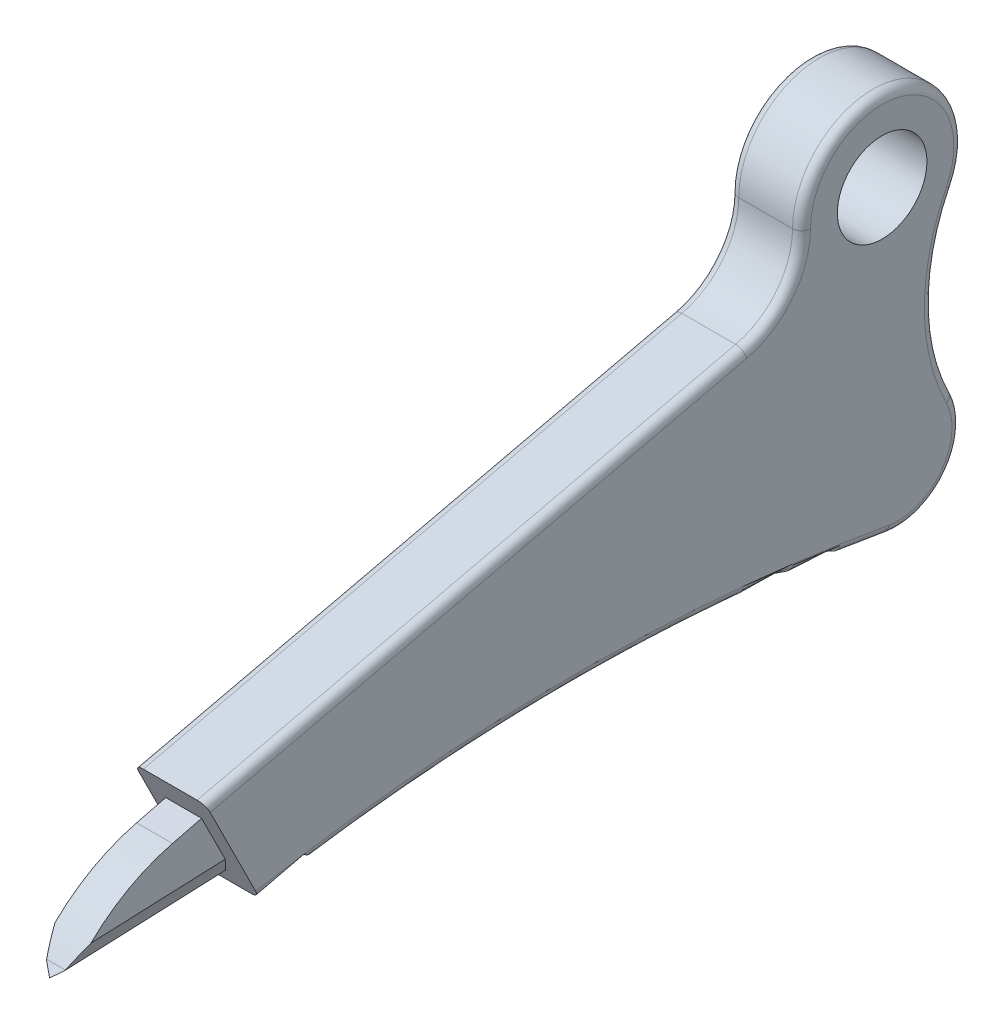
from build123d import *

# Parameters (mm, degrees)
SKETCH1_R           = 6.35
BOSS_EXTRUDE1_DEPTH = 5.08
FILLET1_R           = 1.27
BOSS_EXTRUDE2_DEPTH = 2.54
CHAMFER1_SIZE       = 3.81
CHAMFER1_SIZE_2     = 1.776632178
FILLET2_R           = 25.4


with BuildPart() as part:
    # Sketch1 → Boss-Extrude1 (new, symmetric)
    with BuildSketch(Plane(origin=(0, 0, 0), x_dir=(0, 0, -1), z_dir=(1, 0, 0))):
        with BuildLine():
            Line((-88.177460957, -43.18), (-95.797460957, -27.94))
            Line((-95.797460957, -27.94), (-19.494713075, -10.16))
            ThreePointArc((-19.494713075, -10.16), (-13.691248965, -6.485853779), (-11.43, 0))
            ThreePointArc((-11.43, 0), (2.608865683, 11.128284677), (10.23906734, -5.08))
            ThreePointArc((10.23906734, -5.08), (7.261735691, -17.78), (10.23906734, -30.48))
            ThreePointArc((10.23906734, -30.48), (9.389887981, -39.759205985), (0.722539043, -43.18))
            ThreePointArc((0.722539043, -43.18), (-43.727460957, -39.260382077), (-88.177460957, -43.18))
        make_face()
        Circle(SKETCH1_R, mode=Mode.SUBTRACT)
    extrude(amount=BOSS_EXTRUDE1_DEPTH, both=True)

    # Fillet1
    fillet1_edges = [part.edges().sort_by_distance(p)[0] for p in [
        (5.08, -39.260382077, 43.727460957),
        (5.08, -39.759205985, -9.389887981),
        (5.08, -17.78, -7.261735691),
        (5.08, 11.128284677, -2.608865683),
        (5.08, -6.485853779, 13.691248965),
        (-5.08, 11.128284677, -2.608865683),
        (5.08, -19.05, 57.646087016),
        (-5.08, -17.78, -7.261735691),
        (-5.08, -39.759205985, -9.389887981),
        (-5.08, -39.260382077, 43.727460957),
        (-5.08, -19.05, 57.646087016),
        (-5.08, -6.485853779, 13.691248965),
    ]]
    fillet(fillet1_edges, radius=FILLET1_R)

    # Sketch3 → Boss-Extrude2 (add, symmetric)
    with BuildSketch(Plane(origin=(0, 0, 0), x_dir=(0, 0, -1), z_dir=(1, 0, 0))):
        Polygon((-93.892460957, -31.75), (-106.592460957, -34.925), (-112.942460957, -43.18), (-92.622460957, -42.339662192), (-43.915351624, -37.990451226), align=None)
    extrude(amount=BOSS_EXTRUDE2_DEPTH, both=True)

    # Chamfer1
    # the kernel refuses this chamfer: 3.81, 1.776632178 mm, written as the material it takes off along each edge
    with BuildSketch(Plane(origin=(-2.54, -43.587894094, 122.805646834), x_dir=(-0.016311164131110324, 0.9990130464553615, 0.041314391398951954), z_dir=(0, 0.041319888426956664, -0.999145968725483))) as chamfer1_piece_1_section:
        Polygon((CHAMFER1_SIZE * 0.999866964113, CHAMFER1_SIZE * 0.0163111641311), (-CHAMFER1_SIZE_2 * 0.0163111641272, CHAMFER1_SIZE_2 * 0.999866963871), (0, 0), align=None)
    chamfer1_piece_1 = extrude(amount=40.080601841, mode=Mode.PRIVATE)
    chamfer1_piece_1 = split(chamfer1_piece_1, bisect_by=Plane(origin=(-1.976451392, -34.769993735, 92.38246409), z_dir=(0, -0.44721359549995887, 0.8944271909999154)), keep=Keep.TOP, mode=Mode.PRIVATE)
    add(chamfer1_piece_1, mode=Mode.SUBTRACT)
    with BuildSketch(Plane(origin=(2.54, -43.587894094, 122.805646834), x_dir=(0.016311164131110324, 0.9990130464553615, 0.041314391398951954), z_dir=(0, 0.041319888426956664, -0.999145968725483))) as chamfer1_piece_2_section:
        Polygon((CHAMFER1_SIZE * 0.999866964113, -CHAMFER1_SIZE * 0.0163111641311), (-CHAMFER1_SIZE_2 * 0.0163111641272, -CHAMFER1_SIZE_2 * 0.999866963871), (0, 0), align=None)
    chamfer1_piece_2 = extrude(amount=40.080601841, mode=Mode.PRIVATE)
    chamfer1_piece_2 = split(chamfer1_piece_2, bisect_by=Plane(origin=(1.976451392, -34.769993735, 92.38246409), z_dir=(0, -0.44721359549995887, 0.8944271909999154)), keep=Keep.TOP, mode=Mode.PRIVATE)
    add(chamfer1_piece_2, mode=Mode.SUBTRACT)

    # Fillet2
    fillet2_edges = [part.edges().sort_by_distance(p)[0] for p in [
        (0, -34.925, 106.592460957),
    ]]
    fillet(fillet2_edges, radius=FILLET2_R)

    # Chamfer2
    # the kernel refuses this chamfer: 1.27, 0.83499617 mm, written as the material it takes off along each edge
    with BuildSketch(Plane(origin=(-0.763367822, -43.506315275, 120.833009659), x_dir=(0.9993026620124814, -0.03730696112582517, -0.0015428371024072082), z_dir=(0, 0.04131988842701986, -0.9991459687254804))) as chamfer2_piece_1_section:
        with BuildLine():
            Line((0.874521065, 0), (-0.619435505, -1.161345341))
            Line((-0.619435505, -1.161345341), (-0.642038856, -1.149758774))
            ThreePointArc((-0.642038856, -1.149758774), (-0.322768515, -0.573982799), (-0.022603351, 0.011586567))
            Line((-0.022603351, 0.011586567), (0.000948407, 0.025382288))
            ThreePointArc((0.000948407, 0.025382288), (0.437599315, 0.009066868), (0.875469472, 0.025382288))
            Line((0.875469472, 0.025382288), (0.874521065, 0))
        make_face()
    chamfer2_piece_1 = extrude(amount=36.131955223, mode=Mode.PRIVATE)
    chamfer2_piece_1 = split(chamfer2_piece_1, bisect_by=Plane(origin=(-0.672553729, -35.934823141, 91.800049387), z_dir=(0, -0.44721359549995887, 0.8944271909999154)), keep=Keep.TOP, mode=Mode.PRIVATE)
    add(chamfer2_piece_1, mode=Mode.SUBTRACT)
    with BuildSketch(Plane(origin=(0.763367822, -43.506315275, 120.833009659), x_dir=(0.4373449734128742, 0.8985257946973667, 0.03715872029494756), z_dir=(0, 0.04131988842701986, -0.9991459687254804))) as chamfer2_piece_2_section:
        with BuildLine():
            Line((1.316215539, 0), (-0.411565873, -0.771622074))
            Line((-0.411565873, -0.771622074), (-0.434407936, -0.760513512))
            ThreePointArc((-0.434407936, -0.760513512), (-0.213942404, -0.381842921), (-0.022842063, 0.011108562))
            Line((-0.022842063, 0.011108562), (0.000414304, 0.025396621))
            ThreePointArc((0.000414304, 0.025396621), (0.658346981, 0.014663545), (1.316629843, 0.025396621))
            Line((1.316629843, 0.025396621), (1.316215539, 0))
        make_face()
    chamfer2_piece_2 = extrude(amount=36.131955223, mode=Mode.PRIVATE)
    chamfer2_piece_2 = split(chamfer2_piece_2, bisect_by=Plane(origin=(0.672553729, -35.934823141, 91.800049387), z_dir=(0, -0.44721359549995887, 0.8944271909999154)), keep=Keep.TOP, mode=Mode.PRIVATE)
    add(chamfer2_piece_2, mode=Mode.SUBTRACT)


solid = part.part
